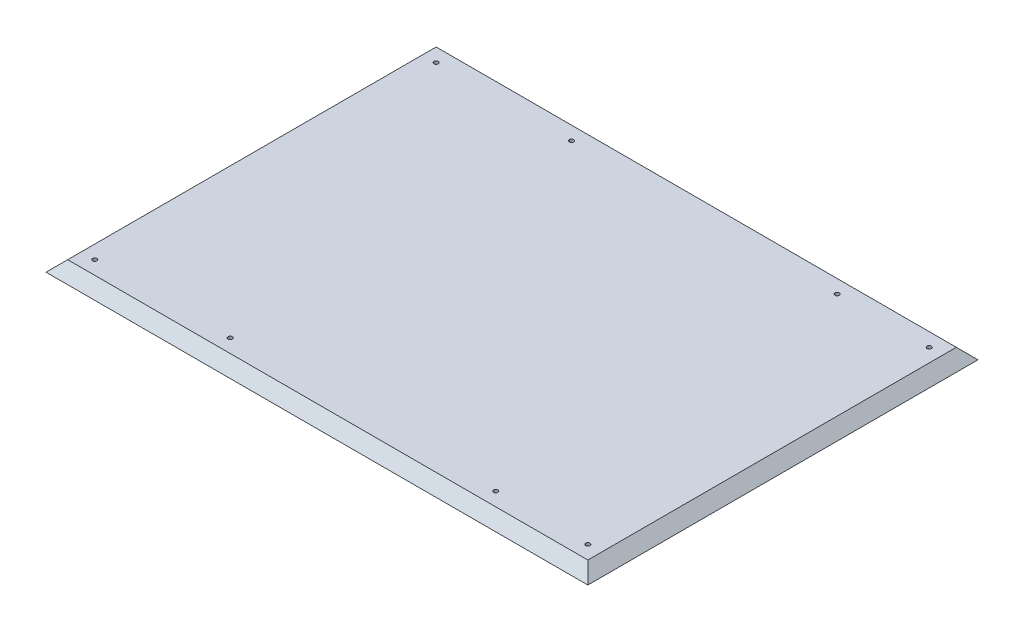
from build123d import *

# Parameters (mm, degrees)
SKIZZE1_W                       = 500
SKIZZE1_H                       = 360
AUFSATZ_LINEAR_AUSTRAGEN1_DEPTH = 20
FASE1_SIZE                      = 10
SKIZZE3_R                       = 2
SCHNITT_LINEAR_AUSTRAGEN1_DEPTH = 309.706980809


with BuildPart() as part:
    # Skizze1 → Aufsatz-Linear austragen1 (new body)
    with BuildSketch(Plane(origin=(0, 0, 0), x_dir=(1, 0, 0), z_dir=(0, 1, 0))):
        Rectangle(SKIZZE1_W, SKIZZE1_H)
    extrude(amount=AUFSATZ_LINEAR_AUSTRAGEN1_DEPTH)

    # Fase1
    fase1_edges = [part.edges().sort_by_distance(p)[0] for p in [
        (0, 20, 180),
        (-250, 20, 0),
        (0, 20, -180),
        (250, 20, 0),
        (0, 0, -180),
        (-250, 0, 0),
        (0, 0, 180),
        (250, 0, 0),
    ]]
    chamfer(fase1_edges, length=FASE1_SIZE - 0.0001)  # a hair under: the kernel refuses the full size

    # Skizze3 → Schnitt-Linear austragen1 (cut, through all)
    with BuildSketch(Plane(origin=(0, 20, 0), x_dir=(1, 0, 0), z_dir=(0, 1, 0))):
        with Locations(Location((-227.5, 157.5, 0), (0, 0, 270))):
            Circle(SKIZZE3_R)
        with Locations(Location((-102.5, 157.5, 0), (0, 0, 270))):
            Circle(SKIZZE3_R)
        with Locations(Location((142.5, 157.5, 0), (0, 0, 270))):
            Circle(SKIZZE3_R)
        with Locations(Location((227.5, 157.5, 0), (0, 0, 270))):
            Circle(SKIZZE3_R)
        with Locations(Location((227.5, -157.5, 0), (0, 0, 270))):
            Circle(SKIZZE3_R)
        with Locations(Location((142.5, -157.5, 0), (0, 0, 270))):
            Circle(SKIZZE3_R)
        with Locations(Location((-102.5, -157.5, 0), (0, 0, 270))):
            Circle(SKIZZE3_R)
        with Locations(Location((-227.5, -157.5, 0), (0, 0, 270))):
            Circle(SKIZZE3_R)
    extrude(amount=-SCHNITT_LINEAR_AUSTRAGEN1_DEPTH, mode=Mode.SUBTRACT)


solid = part.part
